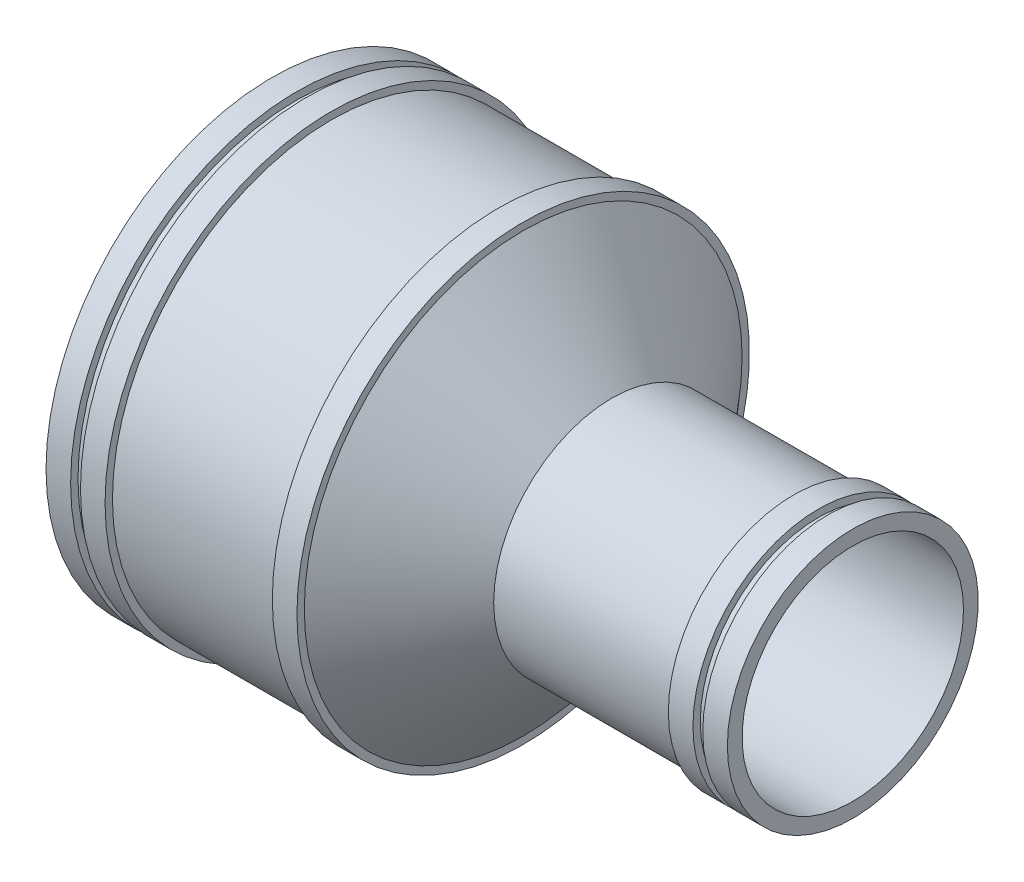
from build123d import *

# Parameters (mm, degrees)
SKELETON_R          = 44.5
SKELETON_R_2        = 41.5
BOSS_EXTRUDE1_DEPTH = 51
BOSS_EXTRUDE2_START = 69
SKELETON_3_R        = 24
SKELETON_3_R_2      = 22
BOSS_EXTRUDE2_DEPTH = 49
SKETCH4_W           = 5
SKETCH4_H           = 1.5
SKETCH6_R           = 22.5
CUT_EXTRUDE1_DEPTH  = 39


with BuildPart() as part:
    # Skeleton → Boss-Extrude1 (new body)
    with BuildSketch(Plane(origin=(0, 0, 0), x_dir=(0, 0, -1), z_dir=(1, 0, 0))):
        Circle(SKELETON_R)
        Circle(SKELETON_R_2, mode=Mode.SUBTRACT)
    extrude(amount=BOSS_EXTRUDE1_DEPTH)



with BuildPart() as body_2:
    # Skeleton<3> → Boss-Extrude2 (new body)
    with BuildSketch(Plane(origin=(0, 0, 0), x_dir=(0, 0, -1), z_dir=(1, 0, 0)).offset(BOSS_EXTRUDE2_START)):
        Circle(SKELETON_3_R)
        Circle(SKELETON_3_R_2, mode=Mode.SUBTRACT)
    extrude(amount=BOSS_EXTRUDE2_DEPTH)


with BuildPart() as part_1:
    add(part.part)

    add(body_2.part)  # loft1 joins it to this body
    # loft up to a face of the part (loft1)
    loft([Face(Wire([part_1.edges().sort_by_distance((51, 32.43910392, 30.462346214))[0]])), Face(Wire([part_1.edges().sort_by_distance((69, -17.495247058, 16.429130542))[0]]))])

    # Cut-Loft1: read off the stored shape, not the designer's step
    # Cut-Loft1: loft between two sections, ruled curve by curve
    cut_loft1_from = [
        Edge.make_bspline([(69, 9.116262782, -20.022331355), (69, -30.928399928, -38.254856919), (69, -49.160925492, 1.789805791), (69, -9.116262782, 20.022331355), (69, 30.928399928, 38.254856919), (69, 49.160925492, -1.789805791), (69, 9.116262782, -20.022331355)], [0, 0, 0, 0, 0.5, 0.5, 0.5, 1, 1, 1, 1], 3, [1, 0.333333333, 0.333333333, 1, 0.333333333, 0.333333333, 1]),
    ]
    cut_loft1_to = [
        Edge.make_bspline([(51, 27.366118575, -31.198486408), (51, -35.030854242, -85.930723557), (51, -89.763091391, -23.533750741), (51, -27.366118575, 31.198486408), (51, 35.030854242, 85.930723557), (51, 89.763091391, 23.533750741), (51, 27.366118575, -31.198486408)], [0, 0, 0, 0, 0.5, 0.5, 0.5, 1, 1, 1, 1], 3, [1, 0.333333333, 0.333333333, 1, 0.333333333, 0.333333333, 1]),
    ]
    cut_loft1 = Solid(Shell([*[Face.make_surface_from_curves(cut_loft1_from[k], cut_loft1_to[k]) for k in range(1)], Face(Wire(cut_loft1_from)), Face(Wire(cut_loft1_to))]))
    add(cut_loft1, mode=Mode.SUBTRACT)

    # Sketch4 → Revolve1 (revolve)
    with BuildSketch(Plane.XY, mode=Mode.PRIVATE) as revolve1_sk:
        with Locations((9.5, 45.25)):
            Rectangle(SKETCH4_W, SKETCH4_H)
        with Locations((2.5, 45.25)):
            Rectangle(SKETCH4_W, SKETCH4_H)
        with Locations((48.5, 45.25)):
            Rectangle(SKETCH4_W, SKETCH4_H)
        with Locations((108.5, 24.75)):
            Rectangle(SKETCH4_W, SKETCH4_H)
        with Locations((115.5, 24.75)):
            Rectangle(SKETCH4_W, SKETCH4_H)
    revolve(revolve1_sk.sketch.rotate(Axis((0, 0, 0), (1, 0, 0)), 90), axis=Axis((0, 0, 0), (1, 0, 0)))

    # Sketch6 → Cut-Extrude1 (cut)
    with BuildSketch(Plane(origin=(118, 0, 0), x_dir=(0, 0, -1), z_dir=(1, 0, 0))):
        Circle(SKETCH6_R)
    extrude(amount=-CUT_EXTRUDE1_DEPTH, mode=Mode.SUBTRACT)


solid = part_1.part
